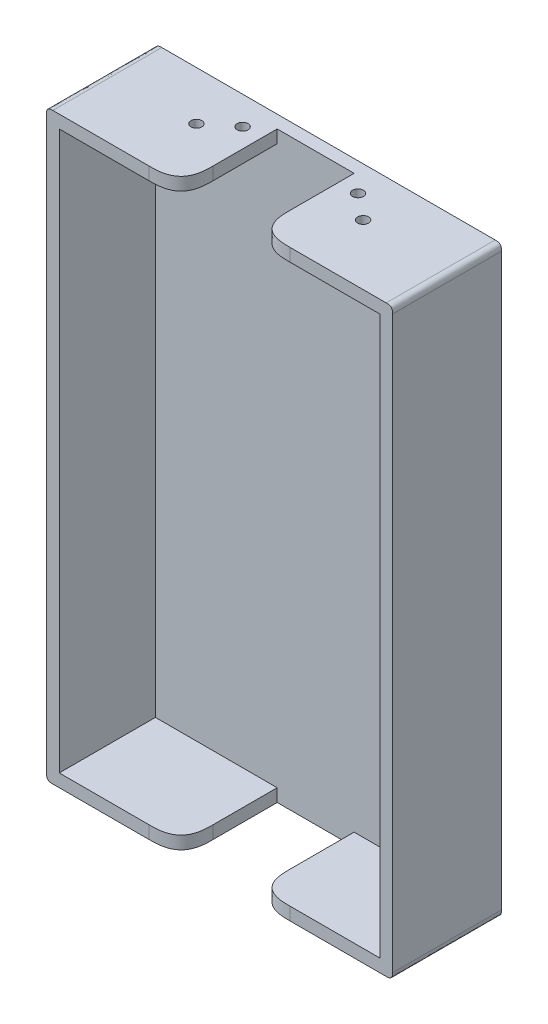
from build123d import *

# Parameters (mm, degrees)
SKETCH_1_W          = 54
SKETCH_1_H          = 91
SKETCH_1_W_2        = 50
SKETCH_1_H_2        = 87
EXTRUDE_1_DEPTH     = 17
SKETCH_2_W          = 54
SKETCH_2_H          = 91
EXTRUDE_2_DEPTH     = 2
SKETCH_3_W          = 12
SKETCH_3_H          = 98.630911944
CUT_EXTRUDE_1_DEPTH = 15
SKETCH_5_R          = 0.85
CUT_EXTRUDE_2_DEPTH = 11
FILLET_1_SIZE       = 1
FILLET_2_SIZE       = 5


with BuildPart() as part:
    # 草图1 → 凸台-拉伸1 (new body)
    with BuildSketch(Plane.XY):
        Rectangle(SKETCH_1_W, SKETCH_1_H)
        Rectangle(SKETCH_1_W_2, SKETCH_1_H_2, mode=Mode.SUBTRACT)
    extrude(amount=EXTRUDE_1_DEPTH)

    # 草图2 → 凸台-拉伸2 (add)
    with BuildSketch(Plane(origin=(0, 0, 0), x_dir=(-1, 0, 0), z_dir=(0, 0, -1))):
        Rectangle(SKETCH_2_W, SKETCH_2_H)
    extrude(amount=-EXTRUDE_2_DEPTH)

    # 草图3 → 切除-拉伸1 (cut)
    with BuildSketch(Plane.XY.offset(17)):
        Rectangle(SKETCH_3_W, SKETCH_3_H)
    extrude(amount=-CUT_EXTRUDE_1_DEPTH, mode=Mode.SUBTRACT)

    # 草图5 → 切除-拉伸2 (cut)
    with BuildSketch(Plane(origin=(0, 45.5, 0), x_dir=(1, 0, 0), z_dir=(0, 1, 0))):
        with Locations(Location((-9, -4.4, 0), (0, 0, 270))):
            Circle(SKETCH_5_R)
        with Locations(Location((-13, -7.6, 0), (0, 0, 270))):
            Circle(SKETCH_5_R)
        with Locations(Location((9, -4.4, 0), (0, 0, 270))):
            Circle(SKETCH_5_R)
        with Locations(Location((13, -7.6, 0), (0, 0, 270))):
            Circle(SKETCH_5_R)
    extrude(amount=-CUT_EXTRUDE_2_DEPTH, mode=Mode.SUBTRACT)

    # 圆角1
    # a fillet whose section is not a circle: 1 mm, written as the material it takes off along each edge
    with BuildSketch(Plane(origin=(-27, -45.5, -2.5), x_dir=(0, 1, 0), z_dir=(0, 0, 1)), Plane(origin=(27, -45.5, 19.5), x_dir=(0, 1, 0), z_dir=(0, 0, -1)), Plane(origin=(27, 45.5, 19.5), x_dir=(-1, 0, 0), z_dir=(0, 0, -1)), Plane(origin=(-27, 45.5, -2.5), x_dir=(1, 0, 0), z_dir=(0, 0, 1))) as fillet_1_piece_1:
        with BuildLine():
            add(Edge.make_bspline([(FILLET_1_SIZE, 0), (FILLET_1_SIZE * 0.831801948466, 0), (FILLET_1_SIZE * 0.663603896932, 0), (FILLET_1_SIZE * 0.292893218813, -FILLET_1_SIZE * 0.0716919198361), (FILLET_1_SIZE * 0.0716919198361, -FILLET_1_SIZE * 0.292893218813), (0, -FILLET_1_SIZE * 0.663603896932), (0, -FILLET_1_SIZE * 0.831801948466), (0, -FILLET_1_SIZE)], knots=[0, 0, 0, 0, 0, 0, 0.5, 0.5, 1, 1, 1, 1, 1, 1], degree=5))
            Line((0, -FILLET_1_SIZE), (0, 0))
            Line((0, 0), (FILLET_1_SIZE, 0))
        make_face()
    extrude(amount=22, mode=Mode.SUBTRACT)

    # 圆角2
    # a fillet whose section is not a circle: 5 mm, written as the material it takes off along each edge
    with BuildSketch(Plane(origin=(6, -31, 17), x_dir=(1, 0, 0), z_dir=(0, -1, 0)), Plane(origin=(-6, -58, 17), x_dir=(-1, 0, 0), z_dir=(0, 1, 0)), Plane(origin=(6, 58, 17), x_dir=(1, 0, 0), z_dir=(0, -1, 0))) as fillet_2_piece_1:
        with BuildLine():
            add(Edge.make_bspline([(FILLET_2_SIZE, 0), (FILLET_2_SIZE * 0.831801948466, 0), (FILLET_2_SIZE * 0.663603896932, 0), (FILLET_2_SIZE * 0.292893218813, -FILLET_2_SIZE * 0.0716919198361), (FILLET_2_SIZE * 0.0716919198361, -FILLET_2_SIZE * 0.292893218813), (0, -FILLET_2_SIZE * 0.663603896932), (0, -FILLET_2_SIZE * 0.831801948466), (0, -FILLET_2_SIZE)], knots=[0, 0, 0, 0, 0, 0, 0.5, 0.5, 1, 1, 1, 1, 1, 1], degree=5))
            Line((0, -FILLET_2_SIZE), (0, 0))
            Line((0, 0), (FILLET_2_SIZE, 0))
        make_face()
    extrude(amount=27, mode=Mode.SUBTRACT)
    with BuildSketch(Plane(origin=(-6, 31, 17), x_dir=(0, 0, -1), z_dir=(0, 1, 0))) as fillet_2_piece_2:
        with BuildLine():
            add(Edge.make_bspline([(FILLET_2_SIZE, 0), (FILLET_2_SIZE * 0.831801948466, 0), (FILLET_2_SIZE * 0.663603896932, 0), (FILLET_2_SIZE * 0.292893218813, FILLET_2_SIZE * 0.0716919198361), (FILLET_2_SIZE * 0.0716919198361, FILLET_2_SIZE * 0.292893218813), (0, FILLET_2_SIZE * 0.663603896932), (0, FILLET_2_SIZE * 0.831801948466), (0, FILLET_2_SIZE)], knots=[0, 0, 0, 0, 0, 0, 0.5, 0.5, 1, 1, 1, 1, 1, 1], degree=5))
            Line((0, FILLET_2_SIZE), (0, 0))
            Line((0, 0), (FILLET_2_SIZE, 0))
        make_face()
    extrude(amount=27, mode=Mode.SUBTRACT)


solid = part.part
